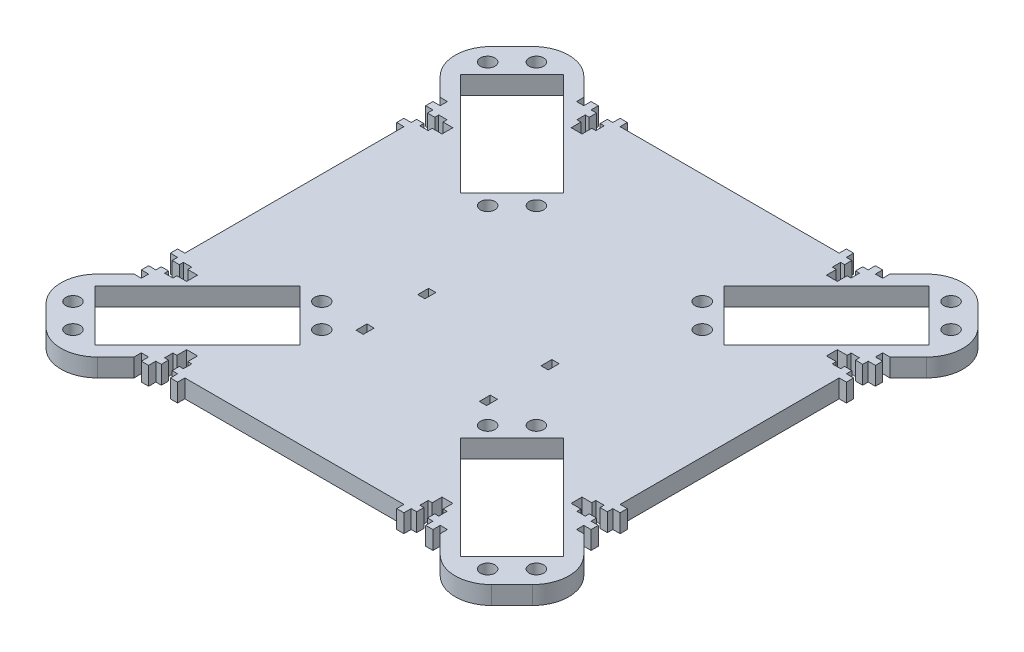
from build123d import *
from OCP.BRepAlgoAPI import BRepAlgoAPI_Cut
from OCP.TopTools import TopTools_ListOfShape

# Parameters (mm, degrees)
SKETCH1_W           = 120
SKETCH1_H           = 120
BOSS_EXTRUDE1_DEPTH = 5
BOSS_EXTRUDE3_DEPTH = 5
SKETCH3_R           = 2
CUT_EXTRUDE1_DEPTH  = 5
CUT_EXTRUDE4_DEPTH  = 10
FILLET1_R           = 10
CUT_EXTRUDE6_DEPTH  = 10
SKETCH9_W           = 2
SKETCH9_H           = 2
BOSS_EXTRUDE4_DEPTH = 5
SKETCH10_W          = 2
SKETCH10_H          = 3
CUT_EXTRUDE7_DEPTH  = 10


with BuildPart() as part:
    # Sketch1 → Boss-Extrude1 (new body)
    with BuildSketch(Plane(origin=(0, 0, 0), x_dir=(1, 0, 0), z_dir=(0, 1, 0))):
        with Locations((60, 60)):
            Rectangle(SKETCH1_W, SKETCH1_H)
    extrude(amount=BOSS_EXTRUDE1_DEPTH)

    # Sketch2 → Boss-Extrude3 (add)
    with BuildSketch(Plane(origin=(0, 5, 0), x_dir=(1, 0, 0), z_dir=(0, 1, 0))):
        Polygon((100.201009868, 120), (120, 100.201010386), (134.142135439, 114.343146195), (114.343145306, 134.142135809), align=None)
        Polygon((0, 100.201010386), (-14.142135439, 114.343146195), (5.656854694, 134.142135809), (19.798990132, 120), align=None)
        Polygon((19.798990132, 0), (0, 19.798989614), (-14.142135439, 5.656853805), (5.656854694, -14.142135809), align=None)
        Polygon((120, 19.798989614), (134.142135439, 5.656853805), (114.343145306, -14.142135809), (100.201009868, 0), align=None)
    extrude(amount=-BOSS_EXTRUDE3_DEPTH)

    # Sketch3 → Cut-Extrude1 (cut)
    with BuildSketch(Plane(origin=(0, 5, 0), x_dir=(1, 0, 0), z_dir=(0, 1, 0))):
        with Locations((2.835499555, -3.882017503)):
            Circle(SKETCH3_R)
        with Locations((-3.882014955, 2.835496831)):
            Circle(SKETCH3_R)
        with Locations((37.130177993, 30.412661833)):
            Circle(SKETCH3_R)
        with Locations((30.412663484, 37.130176167)):
            Circle(SKETCH3_R)
        with Locations((117.164500445, -3.882017503)):
            Circle(SKETCH3_R)
        with Locations((123.882014955, 2.835496831)):
            Circle(SKETCH3_R)
        with Locations((82.869822007, 30.412661833)):
            Circle(SKETCH3_R)
        with Locations((89.587336516, 37.130176167)):
            Circle(SKETCH3_R)
        with Locations((117.164500445, 123.882017503)):
            Circle(SKETCH3_R)
        with Locations((123.882014955, 117.164503169)):
            Circle(SKETCH3_R)
        with Locations((82.869822007, 89.587338167)):
            Circle(SKETCH3_R)
        with Locations((89.587336516, 82.869823833)):
            Circle(SKETCH3_R)
        with Locations((2.835499555, 123.882017503)):
            Circle(SKETCH3_R)
        with Locations((-3.882014955, 117.164503169)):
            Circle(SKETCH3_R)
        with Locations((37.130177993, 89.587338167)):
            Circle(SKETCH3_R)
        with Locations((30.412663484, 82.869823833)):
            Circle(SKETCH3_R)
        Polygon((9.553013985, -4.589124196), (37.837284862, 23.695147421), (23.695149054, 37.83728286), (-4.589121824, 9.553011243), align=None)
        Polygon((82.162715138, 23.695147421), (96.304850946, 37.83728286), (124.589121824, 9.553011243), (110.446986015, -4.589124196), align=None)
        Polygon((110.446986015, 124.589124196), (82.162715138, 96.304852579), (96.304850946, 82.16271714), (124.589121824, 110.446988757), align=None)
        Polygon((37.837284862, 96.304852579), (23.695149054, 82.16271714), (-4.589121824, 110.446988757), (9.553013985, 124.589124196), align=None)
    extrude(amount=-CUT_EXTRUDE1_DEPTH, mode=Mode.SUBTRACT)


with BuildPart() as cut_extrude4_tool:
    # Sketch6 → Cut-Extrude4 (new body)
    with BuildSketch(Plane(origin=(0, 5, 0), x_dir=(1, 0, 0), z_dir=(0, 1, 0))):
        Polygon((0, 19.798989614), (0, 17.798989562), (-2, 17.798989562), align=None)
        Polygon((17.798989572, -1.99999991), (19.798989614, 1e-07), (17.798989562, 9e-08), align=None)
        Polygon((100.201010386, 1e-07), (102.201010438, 9e-08), (102.201010428, -1.99999991), align=None)
        Polygon((122, 17.798989562), (120, 19.798989614), (120, 17.798989562), align=None)
        Polygon((120, 100.201010386), (120, 102.201010438), (122, 102.201010438), align=None)
        Polygon((102.201010428, 121.99999991), (100.201010386, 119.9999999), (102.201010438, 119.99999991), align=None)
        Polygon((19.798989614, 119.9999999), (17.798989562, 119.99999991), (17.798989572, 121.99999991), align=None)
        Polygon((-2, 102.201010438), (0, 100.201010386), (0, 102.201010438), align=None)
    extrude(amount=-CUT_EXTRUDE4_DEPTH)


with BuildPart() as part_1:
    add(part.part)

    # Cut-Extrude4: cut by cut_extrude4_tool, with a tolerance
    cut_extrude4_stock = TopTools_ListOfShape()
    cut_extrude4_stock.Append(part_1.part.wrapped)
    cut_extrude4_tools = TopTools_ListOfShape()
    cut_extrude4_tools.Append(cut_extrude4_tool.part.wrapped)
    cut_extrude4_cut = BRepAlgoAPI_Cut()
    cut_extrude4_cut.SetArguments(cut_extrude4_stock)
    cut_extrude4_cut.SetTools(cut_extrude4_tools)
    cut_extrude4_cut.SetFuzzyValue(0.00001)
    cut_extrude4_cut.Build()
    add(Compound.cast(cut_extrude4_cut.Shape()).solids(), mode=Mode.REPLACE)

    # Fillet1
    fillet1_edges = [part_1.edges().sort_by_distance(p)[0] for p in [
        (5.656854694, 2.5, 14.142135809),
        (-14.142135439, 2.5, -5.656853805),
        (-14.142135439, 2.5, -114.343146195),
        (5.656854694, 2.5, -134.142135809),
        (114.343145306, 2.5, -134.142135809),
        (134.142135439, 2.5, -114.343146195),
        (134.142135439, 2.5, -5.656853805),
        (114.343145306, 2.5, 14.142135809),
    ]]
    fillet(fillet1_edges, radius=FILLET1_R)


with BuildPart() as cut_extrude6_tool:
    # Sketch8 → Cut-Extrude6 (new body)
    with BuildSketch(Plane(origin=(0, 5, 0), x_dir=(1, 0, 0), z_dir=(0, 1, 0))):
        Polygon((23.298989562, 2), (23.298989562, 0), (26.298989562, 0), (26.298989562, 2), (27.398989562, 2), (27.398989562, 4.3), (26.298989562, 4.3), (26.298989562, 7), (23.298989562, 7), (23.298989562, 4.3), (22.198989562, 4.3), (22.198989562, 2), align=None)
        Polygon((93.701010438, 2), (93.701010438, 0), (96.701010438, 0), (96.701010438, 2), (97.801010438, 2), (97.801010438, 4.3), (96.701010438, 4.3), (96.701010438, 7), (93.701010438, 7), (93.701010438, 4.3), (92.601010438, 4.3), (92.601010438, 2), align=None)
        Polygon((96.701010438, 118), (96.701010438, 120), (93.701010438, 120), (93.701010438, 118), (92.601010438, 118), (92.601010438, 115.7), (93.701010438, 115.7), (93.701010438, 113), (96.701010438, 113), (96.701010438, 115.7), (97.801010438, 115.7), (97.801010438, 118), align=None)
        Polygon((26.298989562, 118), (26.298989562, 120), (23.298989562, 120), (23.298989562, 118), (22.198989562, 118), (22.198989562, 115.7), (23.298989562, 115.7), (23.298989562, 113), (26.298989562, 113), (26.298989562, 115.7), (27.398989562, 115.7), (27.398989562, 118), align=None)
        Polygon((2.000002013, 96.701013008), (2.013e-06, 96.701013061), (1.934e-06, 93.701013061), (2.000001934, 93.701013008), (2.000001905, 92.601013008), (4.300001905, 92.601012948), (4.300001934, 93.701012948), (7.000001934, 93.701012877), (7.000002013, 96.701012877), (4.300002013, 96.701012948), (4.300002041, 97.801012948), (2.000002041, 97.801013008), align=None)
        Polygon((2.00000017, 26.298992132), (1.7e-07, 26.298992184), (9.2e-08, 23.298992184), (2.000000092, 23.298992132), (2.000000063, 22.198992132), (4.300000063, 22.198992072), (4.300000092, 23.298992072), (7.000000092, 23.298992001), (7.00000017, 26.298992001), (4.30000017, 26.298992072), (4.300000199, 27.398992072), (2.000000199, 27.398992132), align=None)
        Polygon((118.000000092, 23.298989096), (120.000000092, 23.298989044), (120.00000017, 26.298989044), (118.00000017, 26.298989096), (118.000000199, 27.398989096), (115.700000199, 27.398989156), (115.70000017, 26.298989156), (113.00000017, 26.298989227), (113.000000092, 23.298989227), (115.700000092, 23.298989156), (115.700000063, 22.198989156), (118.000000063, 22.198989096), align=None)
        Polygon((118.000001934, 93.701009972), (120.000001934, 93.70100992), (120.000002013, 96.70100992), (118.000002013, 96.701009972), (118.000002041, 97.801009972), (115.700002041, 97.801010033), (115.700002013, 96.701010033), (113.000002013, 96.701010103), (113.000001934, 93.701010103), (115.700001934, 93.701010033), (115.700001905, 92.601010033), (118.000001905, 92.601009972), align=None)
    extrude(amount=-CUT_EXTRUDE6_DEPTH)


with BuildPart() as part_2:
    add(part_1.part)

    # Cut-Extrude6: cut by cut_extrude6_tool, with a tolerance
    cut_extrude6_stock = TopTools_ListOfShape()
    cut_extrude6_stock.Append(part_2.part.wrapped)
    cut_extrude6_tools = TopTools_ListOfShape()
    cut_extrude6_tools.Append(cut_extrude6_tool.part.wrapped)
    cut_extrude6_cut = BRepAlgoAPI_Cut()
    cut_extrude6_cut.SetArguments(cut_extrude6_stock)
    cut_extrude6_cut.SetTools(cut_extrude6_tools)
    cut_extrude6_cut.SetFuzzyValue(0.00001)
    cut_extrude6_cut.Build()
    add(Compound.cast(cut_extrude6_cut.Shape()).solids(), mode=Mode.REPLACE)


with BuildPart() as boss_extrude4_tool:
    # Sketch9 → Boss-Extrude4 (new body)
    with BuildSketch(Plane(origin=(0, 5, 0), x_dir=(1, 0, 0), z_dir=(0, 1, 0))):
        with Locations((-0.999998536, 99.201012877)):
            Rectangle(SKETCH9_W, SKETCH9_H)
        with Locations((-0.999998536, 91.201012877)):
            Rectangle(SKETCH9_W, SKETCH9_H)
        Polygon((19.798989745, 120.000000641), (19.798989797, 122.000000641), (21.798989797, 122.000000588), (21.798989745, 120.000000588), align=None)
        Polygon((27.798989745, 120.000000431), (29.798989745, 120.000000379), (29.798989797, 122.000000379), (27.798989797, 122.000000431), align=None)
        Polygon((92.201010255, 120.000000431), (92.201010203, 122.000000431), (90.201010203, 122.000000379), (90.201010255, 120.000000379), align=None)
        Polygon((98.201010255, 120.000000588), (100.201010255, 120.000000641), (100.201010203, 122.000000641), (98.201010203, 122.000000588), align=None)
        with Locations((120.999998536, 99.201012877)):
            Rectangle(SKETCH9_W, SKETCH9_H)
        with Locations((120.999998536, 91.201012877)):
            Rectangle(SKETCH9_W, SKETCH9_H)
        with Locations((120.999998536, 28.798986086)):
            Rectangle(SKETCH9_W, SKETCH9_H)
        with Locations((120.999998536, 20.798986086)):
            Rectangle(SKETCH9_W, SKETCH9_H)
        Polygon((98.201010255, -1.625e-06), (98.201010203, -2.000001625), (100.201010203, -2.000001677), (100.201010255, -1.677e-06), align=None)
        Polygon((92.201010255, -1.467e-06), (90.201010255, -1.415e-06), (90.201010203, -2.000001415), (92.201010203, -2.000001467), align=None)
        Polygon((27.798989745, -1.467e-06), (27.798989797, -2.000001467), (29.798989797, -2.000001415), (29.798989745, -1.415e-06), align=None)
        Polygon((21.798989745, -1.625e-06), (19.798989745, -1.677e-06), (19.798989797, -2.000001677), (21.798989797, -2.000001625), align=None)
        with Locations((-0.999998536, 20.798986086)):
            Rectangle(SKETCH9_W, SKETCH9_H)
        with Locations((-0.999998536, 28.798986086)):
            Rectangle(SKETCH9_W, SKETCH9_H)
    extrude(amount=-BOSS_EXTRUDE4_DEPTH)


with BuildPart() as part_3:
    add(part_2.part)


with BuildPart() as part_4:
    # Boss-Extrude4: joined with boss_extrude4_tool
    add(part_3.part.fuse(boss_extrude4_tool.part, tol=0.00001))

    # Sketch10 → Cut-Extrude7 (cut)
    with BuildSketch(Plane(origin=(0, 5, 0), x_dir=(1, 0, 0), z_dir=(0, 1, 0))):
        with Locations((77.000000013, 53.5)):
            Rectangle(SKETCH10_W, SKETCH10_H)
        with Locations((77.000000013, 36.5)):
            Rectangle(SKETCH10_W, SKETCH10_H)
        with Locations((43.000000013, 36.5)):
            Rectangle(SKETCH10_W, SKETCH10_H)
        with Locations((43.000000013, 53.5)):
            Rectangle(SKETCH10_W, SKETCH10_H)
    extrude(amount=-CUT_EXTRUDE7_DEPTH, mode=Mode.SUBTRACT)


solid = part_4.part
